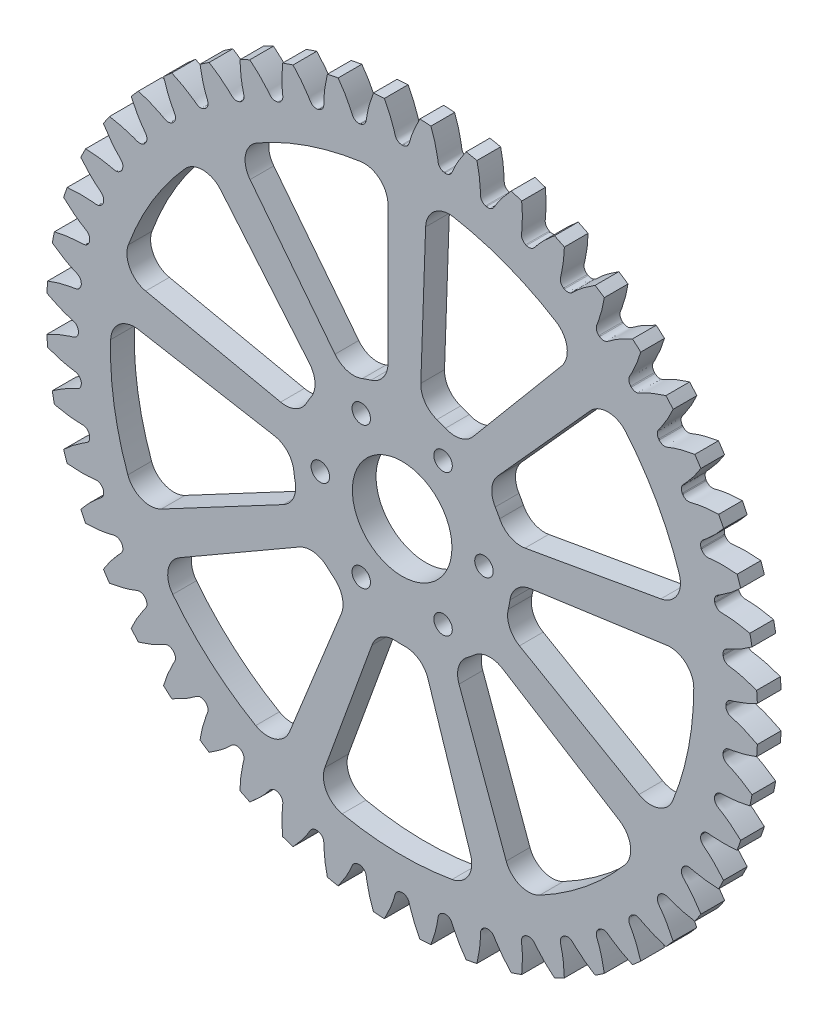
from build123d import *

# Parameters (mm, degrees)
SKETCH_1_R               = 75
EXTRUDE_1_DEPTH          = 5
CUT_EXTRUDE_1_DEPTH      = 107.183802908
PATTERN_CIRCULAR_1_COUNT = 48
SKETCH_4_R               = 1.95
SKETCH_4_R_2             = 10.5
CUT_EXTRUDE_3_DEPTH      = 10


with BuildPart() as part:
    # 草图1 → 凸台-拉伸1 (new body)
    with BuildSketch(Plane.XY):
        Circle(SKETCH_1_R)
    extrude(amount=EXTRUDE_1_DEPTH)

    # 草图2 → 切除-拉伸1 (cut, through all)
    with BuildSketch(Plane.XY):
        with BuildLine():
            ThreePointArc((0.095379345, 68.249933354), (0, 68.25), (-0.095379345, 68.249933354))
            add(Edge.make_bspline(
                [(-0.095379345, 68.249933354), (-1.314422017, 68.407528242), (-1.464123935, 69.32262301), (-1.767231301, 70.318409574), (-1.88900958, 70.697104781), (-2.02758034, 71.098631217), (-2.183351067, 71.522786483), (-2.357441022, 71.968936316), (-2.550740657, 72.436535942), (-2.764187304, 72.924977195), (-2.998683519, 73.433633767), (-3.255119874, 73.961848574), (-3.534367377, 74.508937985), (-3.83727871, 75.074191194), (-4.164686932, 75.656871014), (-4.517404928, 76.256214284), (-4.896224658, 76.871432418), (-5.301916483, 77.501711923), (-5.735228482, 78.146214965), (-6.196885792, 78.804079928), (-6.687589955, 79.474422006), (-7.208018286, 80.156333804), (-7.758823254, 80.848885955), (-8.340631861, 81.551127757), (-8.95404512, 82.262087821), (-9.599637211, 82.980774741), (-10.516385694, 83.961157616), (-11.235624764, 84.684922654), (-11.7307962, 85.164182453)],
                knots=[0, 0, 0, 0, 0.11335438, 0.131183275, 0.150313999, 0.170746552, 0.192480933, 0.215517144, 0.239855183, 0.26549505, 0.292436747, 0.320680272, 0.350225626, 0.381072809, 0.41322182, 0.446672661, 0.48142533, 0.517479827, 0.554836154, 0.593494309, 0.633454293, 0.674716106, 0.717279747, 0.761145218, 0.806312517, 0.852781644, 0.900552601, 1, 1, 1, 1], degree=3))
            ThreePointArc((-11.7307962, 85.164182453), (0, 85.968305511), (11.7307962, 85.164182453))
            add(Edge.make_bspline(
                [(0.095379345, 68.249933354), (1.314422017, 68.407528242), (1.464123935, 69.32262301), (1.767231301, 70.318409574), (1.88900958, 70.697104781), (2.02758034, 71.098631217), (2.183351067, 71.522786483), (2.357441022, 71.968936316), (2.550740657, 72.436535942), (2.764187304, 72.924977195), (2.998683519, 73.433633767), (3.255119874, 73.961848574), (3.534367377, 74.508937985), (3.83727871, 75.074191194), (4.164686932, 75.656871014), (4.517404928, 76.256214284), (4.896224658, 76.871432418), (5.301916483, 77.501711923), (5.735228482, 78.146214965), (6.196885792, 78.804079928), (6.687589955, 79.474422006), (7.208018286, 80.156333804), (7.758823254, 80.848885955), (8.340631861, 81.551127757), (8.95404512, 82.262087821), (9.599637211, 82.980774741), (10.516385694, 83.961157616), (11.235624764, 84.684922654), (11.7307962, 85.164182453)],
                knots=[0, 0, 0, 0, 0.11335438, 0.131183275, 0.150313999, 0.170746552, 0.192480933, 0.215517144, 0.239855183, 0.26549505, 0.292436747, 0.320680272, 0.350225626, 0.381072809, 0.41322182, 0.446672661, 0.48142533, 0.517479827, 0.554836154, 0.593494309, 0.633454293, 0.674716106, 0.717279747, 0.761145218, 0.806312517, 0.852781644, 0.900552601, 1, 1, 1, 1], degree=3))
        make_face()
    cut_extrude_1 = extrude(amount=CUT_EXTRUDE_1_DEPTH, mode=Mode.SUBTRACT)

    # 阵列(圆周)1: 切除-拉伸1 ×48 about axis
    pattern_circular_1_axis = Axis((0, 0, -1.5), (0, 0, 1))
    for i in range(1, PATTERN_CIRCULAR_1_COUNT):
        add(cut_extrude_1.rotate(pattern_circular_1_axis, i * 360 / PATTERN_CIRCULAR_1_COUNT), mode=Mode.SUBTRACT)

    # 草图4 → 切除-拉伸3 (cut)
    with BuildSketch(Plane.XY.offset(5)):
        with Locations((-17.25, 0)):
            Circle(SKETCH_4_R)
        with Locations((-8.625, 14.938938215)):
            Circle(SKETCH_4_R)
        with Locations((8.625, 14.938938215)):
            Circle(SKETCH_4_R)
        with Locations((17.25, 0)):
            Circle(SKETCH_4_R)
        with Locations((8.625, -14.938938215)):
            Circle(SKETCH_4_R)
        with Locations((-8.625, -14.938938215)):
            Circle(SKETCH_4_R)
        Circle(SKETCH_4_R_2)
        with BuildLine():
            Line((-3, 55.930760767), (-3, 26.83281573))
            ThreePointArc((-3, 26.83281573), (-3.991081371, 23.844744207), (-6.571428571, 22.041241492))
            ThreePointArc((-6.571428571, 22.041241492), (-7.488067553, 21.746927239), (-8.391586874, 21.414510728))
            ThreePointArc((-8.391586874, 21.414510728), (-11.535275358, 21.247069897), (-14.155898659, 22.991531771))
            Line((-14.155898659, 22.991531771), (-32.070382429, 45.921025368))
            ThreePointArc((-32.070382429, 45.921025368), (-33.03729506, 49.959374805), (-30.619738277, 53.335556881))
            ThreePointArc((-30.619738277, 53.335556881), (-20.022441499, 58.149392399), (-8.707964602, 60.880385614))
            ThreePointArc((-8.707964602, 60.880385614), (-4.724318621, 59.708314407), (-3, 55.930760767))
        make_face()
        with BuildLine():
            Line((33.653466692, 44.773811314), (14.949668155, 22.483492212))
            ThreePointArc((14.949668155, 22.483492212), (12.269760426, 20.831551452), (9.133830593, 21.108603428))
            ThreePointArc((9.133830593, 21.108603428), (8.24246284, 21.472349809), (7.336653669, 21.798475014))
            ThreePointArc((7.336653669, 21.798475014), (4.820819684, 23.690931902), (3.934624245, 26.711771414))
            Line((3.934624245, 26.711771414), (4.950127882, 55.791990769))
            ThreePointArc((4.950127882, 55.791990769), (6.805230816, 59.507065373), (10.827354762, 60.539395346))
            ThreePointArc((10.827354762, 60.539395346), (22.039628897, 57.41519623), (32.462469651, 52.234452846))
            ThreePointArc((32.462469651, 52.234452846), (34.760726669, 48.775955934), (33.653466692, 44.773811314))
        make_face()
        with BuildLine():
            Line((54.560102302, 12.666697942), (25.904220433, 7.613892812))
            ThreePointArc((25.904220433, 7.613892812), (22.789444956, 8.071044256), (20.565268912, 10.299015224))
            ThreePointArc((20.565268912, 10.299015224), (20.116253264, 11.150621266), (19.631992424, 11.982690578))
            ThreePointArc((19.631992424, 11.982690578), (18.921199619, 15.049543574), (20.184092736, 17.933276344))
            Line((20.184092736, 17.933276344), (39.654418343, 39.55726363))
            ThreePointArc((39.654418343, 39.55726363), (43.463513561, 41.210738706), (47.208208175, 39.416177908))
            ThreePointArc((47.208208175, 39.416177908), (53.789111989, 29.815791645), (58.443353575, 19.14743907))
            ThreePointArc((58.443353575, 19.14743907), (57.980841628, 15.020785594), (54.560102302, 12.666697942))
        make_face()
        with BuildLine():
            Line((49.937459677, -25.367304172), (24.737900077, -10.818331654))
            ThreePointArc((24.737900077, -10.818331654), (22.645694915, -8.465994247), (22.373989349, -5.329596664))
            ThreePointArc((22.373989349, -5.329596664), (22.577425219, -4.388606894), (22.741303737, -3.439927953))
            ThreePointArc((22.741303737, -3.439927953), (24.168139966, -0.633693449), (26.989199915, 0.763601966))
            Line((26.989199915, 0.763601966), (55.803965751, 4.813253209))
            ThreePointArc((55.803965751, 4.813253209), (59.784735268, 3.631449392), (61.499816323, -0.150307235))
            ThreePointArc((61.499816323, -0.150307235), (60.370071782, -11.734753216), (57.077942835, -22.898874247))
            ThreePointArc((57.077942835, -22.898874247), (54.071076405, -25.762777262), (49.937459677, -25.367304172))
        make_face()
        with BuildLine():
            Line((21.948524676, -51.531662738), (11.996441344, -24.188538506))
            ThreePointArc((11.996441344, -24.188538506), (11.905772545, -21.041699953), (13.713671511, -18.464431042))
            ThreePointArc((13.713671511, -18.464431042), (14.474368994, -17.874357114), (15.209706291, -17.252965964))
            ThreePointArc((15.209706291, -17.252965964), (18.106539024, -16.020418264), (21.165760502, -16.763370257))
            Line((21.165760502, -16.763370257), (45.842217393, -32.182931882))
            ThreePointArc((45.842217393, -32.182931882), (48.13201491, -35.647035452), (47.014976918, -39.646461953))
            ThreePointArc((47.014976918, -39.646461953), (38.70320405, -47.79447663), (29.005128292, -54.230549811))
            ThreePointArc((29.005128292, -54.230549811), (24.860853598, -54.491650316), (21.948524676, -51.531662738))
        make_face()
        with BuildLine():
            Line((-16.310368952, -53.583783598), (-6.358285619, -26.240659366))
            ThreePointArc((-6.358285619, -26.240659366), (-4.404993118, -23.771760398), (-1.363425638, -22.959552925))
            ThreePointArc((-1.363425638, -22.959552925), (-0.401405348, -22.996496989), (0.561318234, -22.993149455))
            ThreePointArc((0.561318234, -22.993149455), (3.572687241, -23.911011327), (5.438626519, -26.446575234))
            Line((5.438626519, -26.446575234), (14.430386037, -54.120365472))
            ThreePointArc((14.430386037, -54.120365472), (13.957789848, -58.245876235), (10.531307301, -60.591596501))
            ThreePointArc((10.531307301, -60.591596501), (-1.073322996, -61.490633252), (-12.639508135, -60.187148413))
            ThreePointArc((-12.639508135, -60.187148413), (-15.982038905, -57.72327458), (-16.310368952, -53.583783598))
        make_face()
        with BuildLine():
            Line((-46.937459677, -30.563456595), (-21.737900077, -16.014484076))
            ThreePointArc((-21.737900077, -16.014484076), (-18.654613544, -15.378749959), (-15.802560778, -16.711644828))
            ThreePointArc((-15.802560778, -16.711644828), (-15.089357667, -17.358320345), (-14.349716863, -17.974582775))
            ThreePointArc((-14.349716863, -17.974582775), (-12.632864608, -20.613376448), (-12.833301256, -23.755133737))
            Line((-12.833301256, -23.755133737), (-23.733583322, -50.734278577))
            ThreePointArc((-23.733583322, -50.734278577), (-26.747440208, -53.590824197), (-30.880078046, -53.185249646))
            ThreePointArc((-30.880078046, -53.185249646), (-40.347630283, -46.414639184), (-48.369978233, -37.981511367))
            ThreePointArc((-48.369978233, -37.981511367), (-49.346757783, -33.945537145), (-46.937459677, -30.563456595))
        make_face()
        with BuildLine():
            Line((-55.601991368, 6.757851424), (-26.946109499, 1.705046294))
            ThreePointArc((-26.946109499, 1.705046294), (-24.17553297, 0.210148501), (-22.847502104, -2.644172387))
            ThreePointArc((-22.847502104, -2.644172387), (-22.716831834, -3.597992696), (-22.546359961, -4.54550905))
            ThreePointArc((-22.546359961, -4.54550905), (-22.927358708, -7.670513637), (-25.100384747, -9.948401156))
            Line((-25.100384747, -9.948401156), (-50.792345275, -23.609058887))
            ThreePointArc((-50.792345275, -23.609058887), (-54.937245726, -23.860029922), (-57.84233168, -20.892933393))
            ThreePointArc((-57.84233168, -20.892933393), (-60.742832947, -9.6207196), (-61.467597943, 1.996096965))
            ThreePointArc((-61.467597943, 1.996096965), (-59.621580267, 5.715694383), (-55.601991368, 6.757851424))
        make_face()
        with BuildLine():
            Line((-38.249733351, 40.917085656), (-19.545934814, 18.626766554))
            ThreePointArc((-19.545934814, 18.626766554), (-18.384451839, 15.700716142), (-19.201843274, 12.660537701))
            ThreePointArc((-19.201843274, 12.660537701), (-19.714847916, 11.845875723), (-20.193310658, 11.010458877))
            ThreePointArc((-20.193310658, 11.010458877), (-22.49388686, 8.861467753), (-25.622719255, 8.51329889))
            Line((-25.622719255, 8.51329889), (-54.084804379, 14.563101842))
            ThreePointArc((-54.084804379, 14.563101842), (-57.421303409, 17.035137529), (-57.739515476, 21.175418593))
            ThreePointArc((-57.739515476, 21.175418593), (-52.715788993, 31.674841607), (-45.80384544, 41.039709343))
            ThreePointArc((-45.80384544, 41.039709343), (-41.998802724, 42.702488986), (-38.249733351, 40.917085656))
        make_face()
    extrude(amount=-CUT_EXTRUDE_3_DEPTH, mode=Mode.SUBTRACT)


solid = part.part
